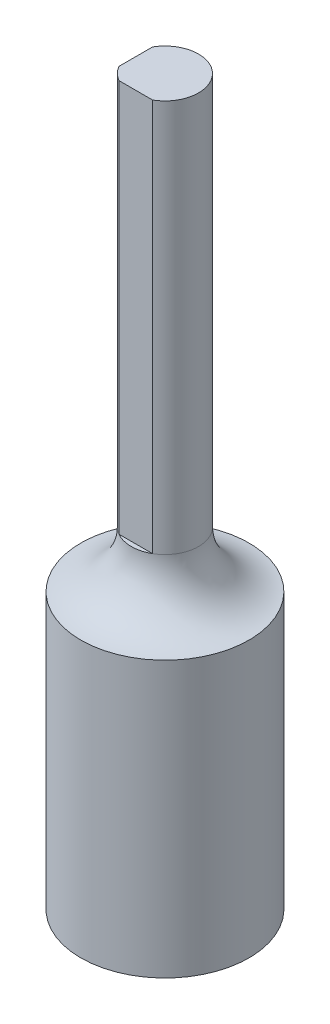
from build123d import *

# Parameters (mm, degrees)
SKETCH1_R            = 7.5
BOSS_EXTRUDE1_DEPTH  = 22
SKETCH3_R            = 7.5
BOSS_EXTRUDE2_DEPTH  = 2.54
M3_CLEARANCE_HOLE1_D = 3.4
SKETCH4_R            = 3
BOSS_EXTRUDE4_DEPTH  = 40
FILLET1_R            = 5
SKETCH12_W           = 15.000000000000002
SKETCH12_H           = 35.32384224330768
CUT_EXTRUDE1_DEPTH   = 0.4
CIRPATTERN2_COUNT    = 2
CIRPATTERN2_ANGLE    = 90.0000000000002


with BuildPart() as part:
    # Sketch1 → Boss-Extrude1 (new body)
    with BuildSketch(Plane(origin=(0, 0, 0), x_dir=(1, 0, 0), z_dir=(0, 1, 0))):
        with Locations(Location((0, 0, 0), (0, 0, 270))):
            Circle(SKETCH1_R)
        with BuildLine():
            Line((-1.5199999999999996, 3.705350860579872), (-1.52, 5.24))
            Line((-1.52, 5.24), (1.52, 5.24))
            Line((1.52, 5.24), (1.5199999999999996, 3.705350860579872))
            ThreePointArc((1.5199999999999994, 3.7053508605798724), (3.3262309751428867, 2.2307425893634614), (4.005, 0))
            ThreePointArc((4.005, -9.8e-16), (-2.2307425893634596, -3.326230975142888), (-1.5199999999999998, 3.7053508605798724))
        make_face(mode=Mode.SUBTRACT)
    extrude(amount=BOSS_EXTRUDE1_DEPTH)

    # Sketch3 → Boss-Extrude2 (add)
    with BuildSketch(Plane(origin=(0, 22, 0), x_dir=(1, 0, 0), z_dir=(0, 1, 0))):
        with Locations(Location((0, 0, 0), (0, 0, 270))):
            Circle(SKETCH3_R)
    extrude(amount=BOSS_EXTRUDE2_DEPTH)

    # M3 Clearance Hole1 (through all)
    with Locations(Plane(origin=(0, 24.54, 0), x_dir=(1, 0, 0), z_dir=(0, 1, 0))):
        with Locations((0, 0)):
            Hole(M3_CLEARANCE_HOLE1_D / 2)

    # Sketch4 → Boss-Extrude4 (add)
    with BuildSketch(Plane(origin=(0, 24.54, 0), x_dir=(1, 0, 0), z_dir=(0, 1, 0))):
        with Locations(Location((0, 0, 0), (0, 0, 270))):
            Circle(SKETCH4_R)
    extrude(amount=BOSS_EXTRUDE4_DEPTH)

    # Fillet1
    # the kernel refuses this fillet: 5 mm, written as the material it adds along each edge
    with BuildSketch(Plane(origin=(0, 24.54, 0), x_dir=(-1.8e-16, 0, 1), z_dir=(-1, 0, -1.8e-16))) as fillet1_piece_1:
        with BuildLine():
            CenterArc((8, 4.974937185533101), FILLET1_R, 180, 84.26082952273322)
            Line((3, 4.974937185533101), (2.9, 4.974937185533101))
            Line((2.9, 4.974937185533101), (2.9, 0))
            Line((2.9, 0), (3, -0.10000000000000142))
            ThreePointArc((3, -0.10000000000000142), (5.25, -0.10000000000000142), (7.49, -0.09949874371066159))
            Line((7.49, -0.09949874371066159), (7.5, 0))
        make_face()
    revolve(axis=Axis((0, 24.54, 0), (0, 1, 0)))

    # Sketch12 → Cut-Extrude1 (cut)
    with BuildSketch(Plane.ZY.offset(3.0000000000000004)):
        with Locations((0, 47.17685830718694)):
            Rectangle(SKETCH12_W, SKETCH12_H)
    cut_extrude1 = extrude(amount=-CUT_EXTRUDE1_DEPTH, mode=Mode.SUBTRACT)

    # CirPattern2: Cut-Extrude1 ×2 about axis
    cirpattern2_axis = Axis((0, 64.54, 0), (0, 1, 0))
    for i in range(1, CIRPATTERN2_COUNT):
        add(cut_extrude1.rotate(cirpattern2_axis, i * CIRPATTERN2_ANGLE / (CIRPATTERN2_COUNT - 1)), mode=Mode.SUBTRACT)


solid = part.part
